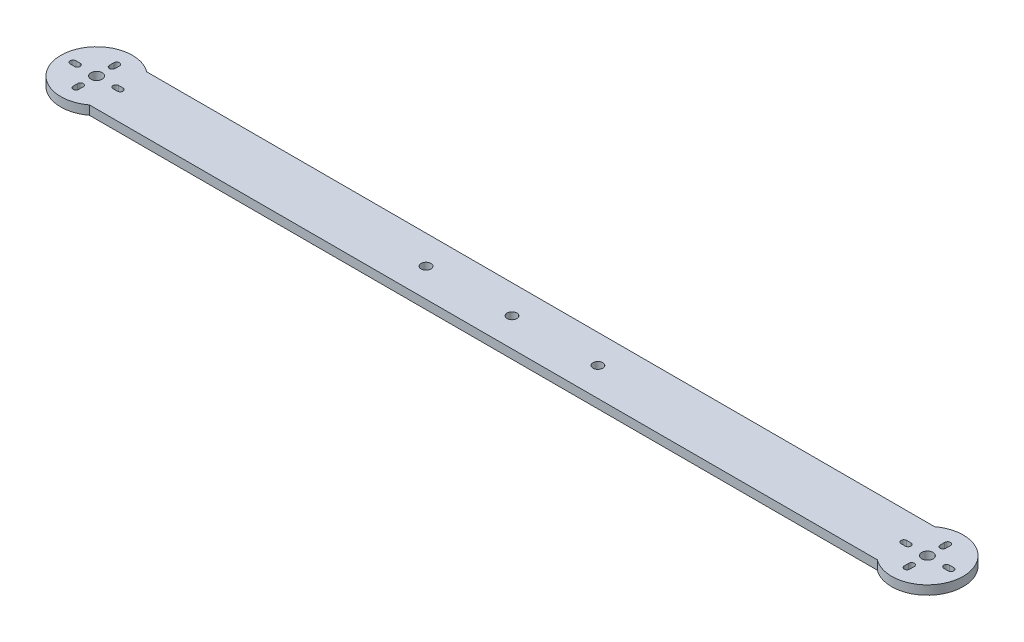
from build123d import *

# Parameters (mm, degrees)
BOSS_EXTRUDE1_DEPTH = 4
SKETCH2_R           = 2.5
CUT_EXTRUDE1_DEPTH  = 201.6938371
SKETCH3_R           = 2.159
CUT_EXTRUDE2_DEPTH  = 201.6938371


with BuildPart() as part:
    # Sketch1 → Boss-Extrude1 (new body)
    with BuildSketch(Plane(origin=(0, 0, 0), x_dir=(1, 0, 0), z_dir=(0, 1, 0))):
        with BuildLine():
            Line((-174.625, 12.7), (174.625, 12.7))
            ThreePointArc((174.625, 12.7), (200.025, 0), (174.625, -12.7))
            Line((174.625, -12.7), (-174.625, -12.7))
            ThreePointArc((-174.625, -12.7), (-200.025, 0), (-174.625, 12.7))
        make_face()
    extrude(amount=BOSS_EXTRUDE1_DEPTH)

    # Sketch2 → Cut-Extrude1 (cut, through all)
    with BuildSketch(Plane(origin=(0, 4, 0), x_dir=(1, 0, 0), z_dir=(0, 1, 0))):
        with Locations((184.15, 0)):
            Circle(SKETCH2_R)
        with Locations((-184.15, 0)):
            Circle(SKETCH2_R)
        with BuildLine():
            Line((173.691383345, 1.25), (175.608616655, 1.25))
            ThreePointArc((175.608616655, 1.25), (176.858616655, 0), (175.608616655, -1.25))
            Line((175.608616655, -1.25), (173.691383345, -1.25))
            ThreePointArc((173.691383345, -1.25), (172.441383345, 0), (173.691383345, 1.25))
        make_face()
        with BuildLine():
            Line((194.608616655, 1.25), (192.691383345, 1.25))
            ThreePointArc((192.691383345, 1.25), (191.441383345, 0), (192.691383345, -1.25))
            Line((192.691383345, -1.25), (194.608616655, -1.25))
            ThreePointArc((194.608616655, -1.25), (195.858616655, 0), (194.608616655, 1.25))
        make_face()
        with BuildLine():
            Line((185.4, 8.920928665), (185.4, 6.921035691))
            ThreePointArc((185.4, 6.921035691), (184.15, 5.671035691), (182.9, 6.921035691))
            Line((182.9, 6.921035691), (182.9, 8.920928665))
            ThreePointArc((182.9, 8.920928665), (184.15, 10.170928665), (185.4, 8.920928665))
        make_face()
        with BuildLine():
            Line((185.441381345, -9.078964309), (185.441381345, -7.078964309))
            ThreePointArc((185.441381345, -7.078964309), (184.191381345, -5.828964309), (182.941381345, -7.078964309))
            Line((182.941381345, -7.078964309), (182.941381345, -9.078964309))
            ThreePointArc((182.941381345, -9.078964309), (184.191381345, -10.328964309), (185.441381345, -9.078964309))
        make_face()
        with BuildLine():
            Line((-185.441381345, -9.078964309), (-185.441381345, -7.078964309))
            ThreePointArc((-185.441381345, -7.078964309), (-184.191381345, -5.828964309), (-182.941381345, -7.078964309))
            Line((-182.941381345, -7.078964309), (-182.941381345, -9.078964309))
            ThreePointArc((-182.941381345, -9.078964309), (-184.191381345, -10.328964309), (-185.441381345, -9.078964309))
        make_face()
        with BuildLine():
            Line((-185.4, 8.920928665), (-185.4, 6.921035691))
            ThreePointArc((-185.4, 6.921035691), (-184.15, 5.671035691), (-182.9, 6.921035691))
            Line((-182.9, 6.921035691), (-182.9, 8.920928665))
            ThreePointArc((-182.9, 8.920928665), (-184.15, 10.170928665), (-185.4, 8.920928665))
        make_face()
        with BuildLine():
            Line((-194.608616655, 1.25), (-192.691383345, 1.25))
            ThreePointArc((-192.691383345, 1.25), (-191.441383345, 0), (-192.691383345, -1.25))
            Line((-192.691383345, -1.25), (-194.608616655, -1.25))
            ThreePointArc((-194.608616655, -1.25), (-195.858616655, 0), (-194.608616655, 1.25))
        make_face()
        with BuildLine():
            Line((-173.691383345, 1.25), (-175.608616655, 1.25))
            ThreePointArc((-175.608616655, 1.25), (-176.858616655, 0), (-175.608616655, -1.25))
            Line((-175.608616655, -1.25), (-173.691383345, -1.25))
            ThreePointArc((-173.691383345, -1.25), (-172.441383345, 0), (-173.691383345, 1.25))
        make_face()
    extrude(amount=-CUT_EXTRUDE1_DEPTH, mode=Mode.SUBTRACT)

    # Sketch3 → Cut-Extrude2 (cut, through all)
    with BuildSketch(Plane(origin=(0, 4, 0), x_dir=(1, 0, 0), z_dir=(0, 1, 0))):
        Circle(SKETCH3_R)
        with Locations((38.1, 0)):
            Circle(SKETCH3_R)
        with Locations((-38.1, 0)):
            Circle(SKETCH3_R)
    extrude(amount=-CUT_EXTRUDE2_DEPTH, mode=Mode.SUBTRACT)


solid = part.part
